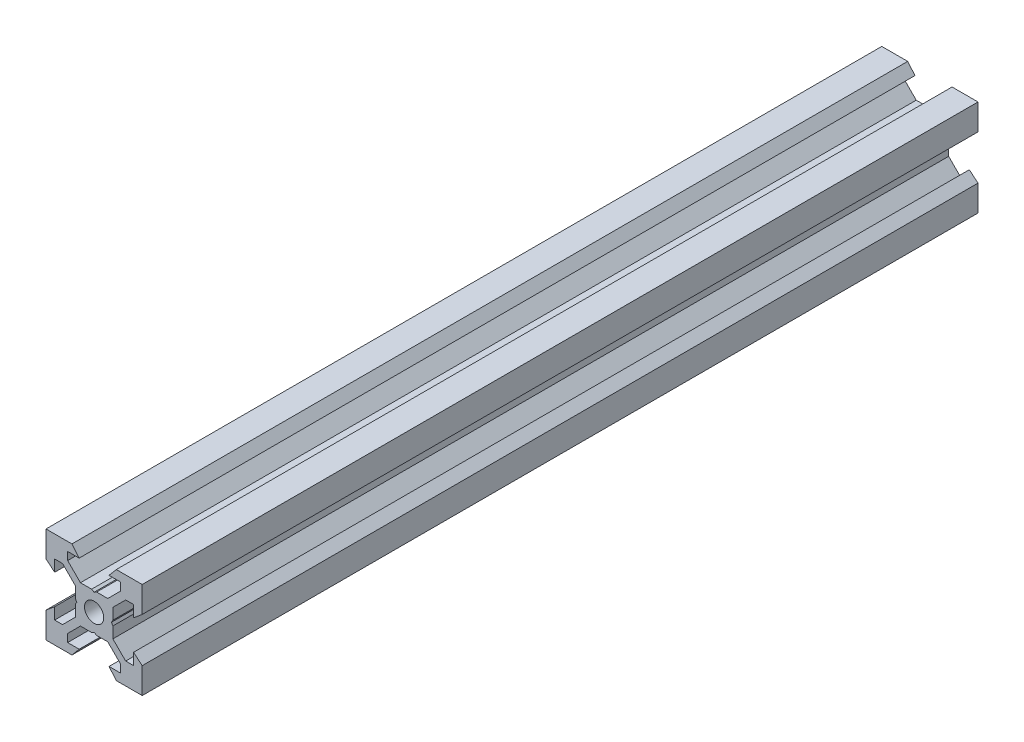
from build123d import *

# Parameters (mm, degrees)
SKETCH1_R           = 2
BOSS_EXTRUDE1_DEPTH = 86.87


with BuildPart() as part:
    # Sketch1 → Boss-Extrude1 (new, symmetric)
    with BuildSketch(Plane.XY):
        Polygon((10, 4.610379336), (10, 10), (4.610379336, 10), (3.1, 8.2), (5.5, 8.2), (5.5, 6.560660172), (2.839339828, 3.9), (0.519615242, 3.9), (0, 3.6), (-0.519615242, 3.9), (-2.839339828, 3.9), (-5.5, 6.560660172), (-5.5, 8.2), (-3.1, 8.2), (-4.610379336, 10), (-10, 10), (-10, 4.610379336), (-8.2, 3.1), (-8.2, 5.5), (-6.560660172, 5.5), (-3.9, 2.839339828), (-3.9, 0.519615242), (-3.6, 0), (-3.9, -0.519615242), (-3.9, -2.839339828), (-6.560660172, -5.5), (-8.2, -5.5), (-8.2, -3.1), (-10, -4.610379336), (-10, -10), (-4.610379336, -10), (-3.1, -8.2), (-5.5, -8.2), (-5.5, -6.560660172), (-2.839339828, -3.9), (-0.519615242, -3.9), (0, -3.6), (0.519615242, -3.9), (2.839339828, -3.9), (5.5, -6.560660172), (5.5, -8.2), (3.1, -8.2), (4.610379336, -10), (10, -10), (10, -4.610379336), (8.2, -3.1), (8.2, -5.5), (6.560660172, -5.5), (3.9, -2.839339828), (3.9, -0.519615242), (3.6, 0), (3.9, 0.519615242), (3.9, 2.839339828), (6.560660172, 5.5), (8.2, 5.5), (8.2, 3.1), align=None)
        Circle(SKETCH1_R, mode=Mode.SUBTRACT)
    extrude(amount=BOSS_EXTRUDE1_DEPTH, both=True)


solid = part.part
